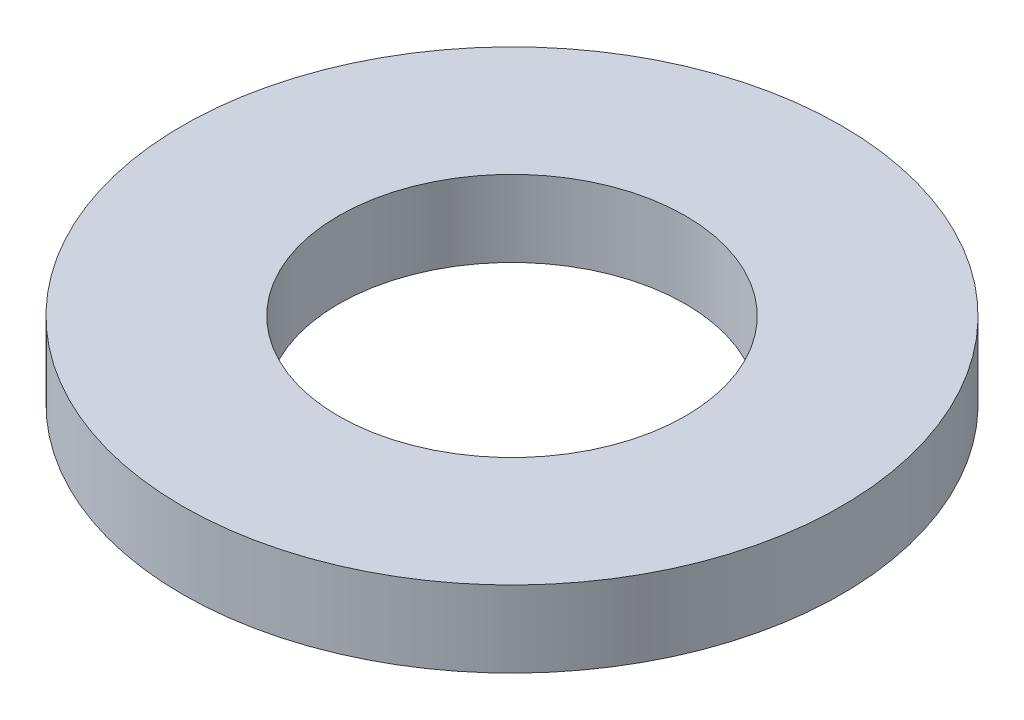
from build123d import *

# Parameters (mm, degrees)
SKETCH1_R           = 95
BOSS_EXTRUDE1_DEPTH = 22
SKETCH2_R           = 50
CUT_EXTRUDE1_DEPTH  = 137.1396342


with BuildPart() as part:
    # Sketch1 → Boss-Extrude1 (new body)
    with BuildSketch(Plane(origin=(0, 0, 0), x_dir=(1, 0, 0), z_dir=(0, 1, 0))):
        Circle(SKETCH1_R)
    extrude(amount=BOSS_EXTRUDE1_DEPTH)

    # Sketch2 → Cut-Extrude1 (cut, through all)
    with BuildSketch(Plane(origin=(0, 0, 0), x_dir=(1, 0, 0), z_dir=(0, 1, 0))):
        Circle(SKETCH2_R)
    extrude(amount=CUT_EXTRUDE1_DEPTH, mode=Mode.SUBTRACT)


solid = part.part
